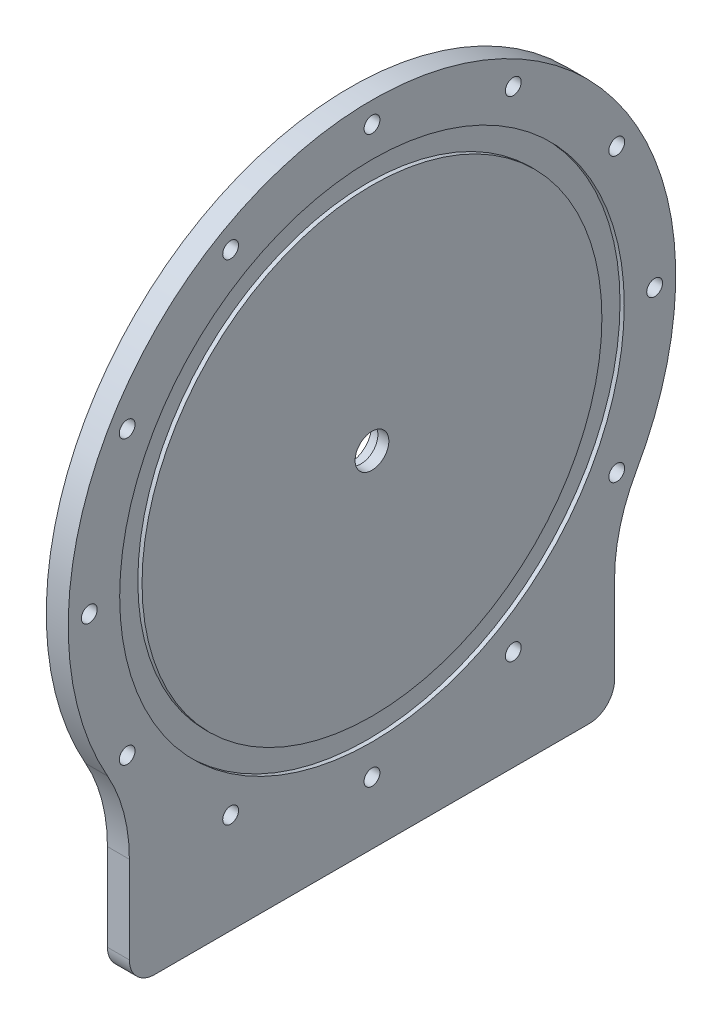
from build123d import *

# Parameters (mm, degrees)
SKETCH1_R           = 5.08
BOSS_EXTRUDE1_DEPTH = 6.604
SKETCH2_R           = 6.477
CUT_EXTRUDE1_DEPTH  = 3.302
SKETCH3_R           = 75.946
SKETCH3_R_2         = 69.215
CUT_EXTRUDE2_DEPTH  = 1.27
SKETCH4_R           = 2.38125
CUT_EXTRUDE3_DEPTH  = 139.530727768
SKETCH5_R           = 3.77825
CUT_EXTRUDE4_DEPTH  = 1.27


with BuildPart() as part:
    # Sketch1 → Boss-Extrude1 (new body)
    with BuildSketch(Plane(origin=(0, 0, 0), x_dir=(0, 0, -1), z_dir=(1, 0, 0))):
        with BuildLine():
            Line((-65.405, -103.855072673), (65.405, -103.855072673))
            ThreePointArc((65.405, -103.855072673), (70.793153673, -101.623226346), (73.025, -96.235072673))
            Line((73.025, -96.235072673), (73.025, -69.997049759))
            ThreePointArc((73.025, -69.997049759), (74.696702219, -57.072253546), (79.601785714, -44.998103417))
            ThreePointArc((79.601785714, -44.998103417), (0, 91.44), (-79.601785714, -44.998103417))
            ThreePointArc((-79.601785714, -44.998103417), (-74.696702219, -57.072253546), (-73.025, -69.997049759))
            Line((-73.025, -69.997049759), (-73.025, -96.235072673))
            ThreePointArc((-73.025, -96.235072673), (-70.793153673, -101.623226346), (-65.405, -103.855072673))
        make_face()
        Circle(SKETCH1_R, mode=Mode.SUBTRACT)
    extrude(amount=BOSS_EXTRUDE1_DEPTH)

    # Sketch2 → Cut-Extrude1 (cut)
    with BuildSketch(Plane(origin=(0, 0, 0), x_dir=(0, 0, -1), z_dir=(1, 0, 0))):
        Circle(SKETCH2_R)
    extrude(amount=CUT_EXTRUDE1_DEPTH, mode=Mode.SUBTRACT)

    # Sketch3 → Cut-Extrude2 (cut)
    with BuildSketch(Plane(origin=(6.604, 0, 0), x_dir=(0, 0, -1), z_dir=(1, 0, 0))):
        Circle(SKETCH3_R)
        Circle(SKETCH3_R_2, mode=Mode.SUBTRACT)
    extrude(amount=-CUT_EXTRUDE2_DEPTH, mode=Mode.SUBTRACT)

    # Sketch4 → Cut-Extrude3 (cut, through all)
    with BuildSketch(Plane.ZY):
        with Locations((0, 85.09)):
            Circle(SKETCH4_R)
        with Locations((42.545, 73.690101608)):
            Circle(SKETCH4_R)
        with Locations((73.690101608, 42.545)):
            Circle(SKETCH4_R)
        with Locations((85.09, 0)):
            Circle(SKETCH4_R)
        with Locations((73.690101608, -42.545)):
            Circle(SKETCH4_R)
        with Locations((42.545, -73.690101608)):
            Circle(SKETCH4_R)
        with Locations((0, -85.09)):
            Circle(SKETCH4_R)
        with Locations((-42.545, -73.690101608)):
            Circle(SKETCH4_R)
        with Locations((-73.690101608, -42.545)):
            Circle(SKETCH4_R)
        with Locations((-85.09, 0)):
            Circle(SKETCH4_R)
        with Locations((-73.690101608, 42.545)):
            Circle(SKETCH4_R)
        with Locations((-42.545, 73.690101608)):
            Circle(SKETCH4_R)
    extrude(amount=-CUT_EXTRUDE3_DEPTH, mode=Mode.SUBTRACT)

    # Sketch5 → Cut-Extrude4 (cut)
    with BuildSketch(Plane.ZY):
        with Locations((0, 85.09)):
            Circle(SKETCH5_R)
        with Locations((42.545, 73.690101608)):
            Circle(SKETCH5_R)
        with Locations((-42.545, 73.690101608)):
            Circle(SKETCH5_R)
        with Locations((73.690101608, 42.545)):
            Circle(SKETCH5_R)
        with Locations((85.09, 0)):
            Circle(SKETCH5_R)
        with Locations((73.690101608, -42.545)):
            Circle(SKETCH5_R)
        with Locations((42.545, -73.690101608)):
            Circle(SKETCH5_R)
        with Locations((0, -85.09)):
            Circle(SKETCH5_R)
        with Locations((-42.545, -73.690101608)):
            Circle(SKETCH5_R)
        with Locations((-73.690101608, -42.545)):
            Circle(SKETCH5_R)
        with Locations((-85.09, 0)):
            Circle(SKETCH5_R)
        with Locations((-73.690101608, 42.545)):
            Circle(SKETCH5_R)
    extrude(amount=-CUT_EXTRUDE4_DEPTH, mode=Mode.SUBTRACT)


solid = part.part
